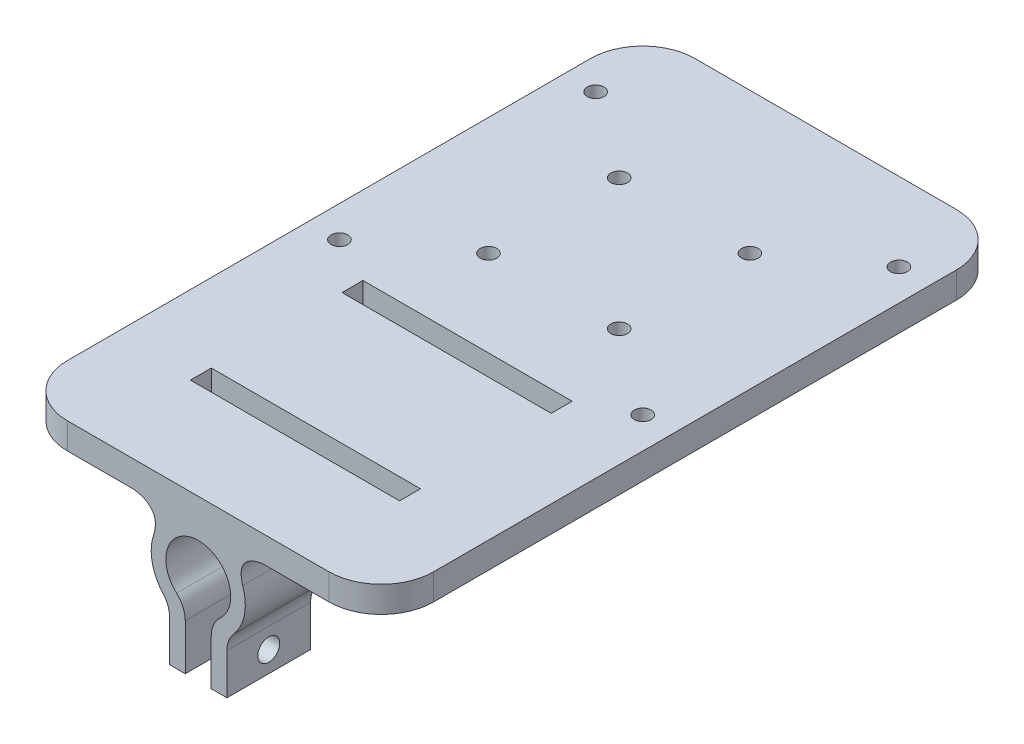
from build123d import *

# Parameters (mm, degrees)
BOSS_EXTRUDE2_START = 10
SKETCH3_W           = 70
SKETCH3_H           = 5
BOSS_EXTRUDE2_DEPTH = 120
BOSS_EXTRUDE3_START = 18
BOSS_EXTRUDE3_DEPTH = 8
SKETCH4_R           = 2.1
CUT_EXTRUDE1_DEPTH  = 11
FILLET1_R           = 10
SKETCH5_R           = 1.6
CUT_EXTRUDE2_DEPTH  = 11
CUT_EXTRUDE5_REACH  = 140.071
SKETCH7_R           = 1.6
CUT_EXTRUDE6_REACH  = 140.071
SKETCH6_W           = 40
SKETCH6_H           = 4


with BuildPart() as part:
    # Sketch3 → Boss-Extrude2 (new body)
    with BuildSketch(Plane.XY.offset(BOSS_EXTRUDE2_START)):
        with Locations((0, 11)):
            Rectangle(SKETCH3_W, SKETCH3_H)
    extrude(amount=BOSS_EXTRUDE2_DEPTH)

    # Sketch1 → Boss-Extrude3 (add, symmetric)
    with BuildSketch(Plane.XY.offset(BOSS_EXTRUDE3_START)):
        with BuildLine():
            Line((-12.351801858, 8.5), (12.351801858, 8.5))
            add(Edge.make_bspline(
                [(12.351801858, 8.5), (9.979182818, 8.152861079), (7.300358033, 7.013004111), (8.498185188, 2.963249653)],
                knots=[0, 0, 0, 0, 1, 1, 1, 1], degree=3))
            ThreePointArc((8.498185188, 2.963249653), (8.830462519, -1.738658018), (6.740539187, -5.96365085))
            ThreePointArc((6.740539187, -5.96365085), (5.809616385, -7.505310599), (5.48528318, -9.276790212))
            Line((5.48528318, -9.276790212), (5.48528318, -17.135241302))
            Line((5.48528318, -17.135241302), (3.98528318, -17.135241302))
            Line((3.98528318, -17.135241302), (2.48528318, -17.135241302))
            Line((2.48528318, -17.135241302), (2.48528318, -8.331298561))
            ThreePointArc((2.48528318, -8.331298561), (2.918653056, -6.295152862), (4.143638903, -4.611968846))
            ThreePointArc((4.143638903, -4.611968846), (0, 6.2), (-4.143638903, -4.611968846))
            ThreePointArc((-4.143638903, -4.611968846), (-2.918653056, -6.295152862), (-2.48528318, -8.331298561))
            Line((-2.48528318, -8.331298561), (-2.48528318, -17.135241302))
            Line((-2.48528318, -17.135241302), (-3.98528318, -17.135241302))
            Line((-3.98528318, -17.135241302), (-5.48528318, -17.135241302))
            Line((-5.48528318, -17.135241302), (-5.48528318, -9.276790212))
            ThreePointArc((-5.48528318, -9.276790212), (-5.809616385, -7.505310599), (-6.740539187, -5.96365085))
            ThreePointArc((-6.740539187, -5.96365085), (-8.830462519, -1.738658018), (-8.498185188, 2.963249653))
            add(Edge.make_bspline(
                [(-12.351801858, 8.5), (-9.979182818, 8.152861079), (-7.300358033, 7.013004111), (-8.498185188, 2.963249653)],
                knots=[0, 0, 0, 0, 1, 1, 1, 1], degree=3))
        make_face()
    boss_extrude3 = extrude(amount=BOSS_EXTRUDE3_DEPTH, both=True)

    # Sketch4 → Cut-Extrude1 (cut)
    with BuildSketch(Plane.ZY.offset(5.48528318)):
        with Locations((18, -13.137995298)):
            Circle(SKETCH4_R)
    cut_extrude1 = extrude(amount=-CUT_EXTRUDE1_DEPTH, mode=Mode.SUBTRACT)

    # Mirror2: Boss-Extrude3, Cut-Extrude1 across plane
    add(boss_extrude3.mirror(Plane.XY.offset(70)))
    add(cut_extrude1.mirror(Plane.XY.offset(70)), mode=Mode.SUBTRACT)

    # Fillet1
    fillet1_edges = [part.edges().sort_by_distance(p)[0] for p in [
        (35, 11, 10),
        (35, 11, 130),
        (-35, 11, 130),
        (-35, 11, 10),
    ]]
    fillet(fillet1_edges, radius=FILLET1_R)

    # Sketch5 → Cut-Extrude2 (cut)
    with BuildSketch(Plane(origin=(0, 13.5, 0), x_dir=(1, 0, 0), z_dir=(0, 1, 0))):
        with Locations((29, -25)):
            Circle(SKETCH5_R)
        with Locations((29, -74)):
            Circle(SKETCH5_R)
        with Locations((-29, -74)):
            Circle(SKETCH5_R)
        with Locations((-29, -25)):
            Circle(SKETCH5_R)
    extrude(amount=-CUT_EXTRUDE2_DEPTH, mode=Mode.SUBTRACT)

    # Sketch7 → Cut-Extrude5 (cut, up to next)
    with BuildSketch(Plane(origin=(0, 13.5, 0), x_dir=(1, 0, 0), z_dir=(0, 1, 0)), mode=Mode.PRIVATE) as cut_extrude5_sk1:
        with Locations((12.5, -37)):
            Circle(SKETCH7_R)
    cut_extrude5_tool1 = extrude(cut_extrude5_sk1.sketch, amount=-CUT_EXTRUDE5_REACH, mode=Mode.PRIVATE) & part.part
    # Sketch7 → Cut-Extrude5 (cut, up to next)
    with BuildSketch(Plane(origin=(0, 13.5, 0), x_dir=(1, 0, 0), z_dir=(0, 1, 0)), mode=Mode.PRIVATE) as cut_extrude5_sk2:
        with Locations((12.5, -62)):
            Circle(SKETCH7_R)
    cut_extrude5_tool2 = extrude(cut_extrude5_sk2.sketch, amount=-CUT_EXTRUDE5_REACH, mode=Mode.PRIVATE) & part.part
    # Sketch7 → Cut-Extrude5 (cut, up to next)
    with BuildSketch(Plane(origin=(0, 13.5, 0), x_dir=(1, 0, 0), z_dir=(0, 1, 0)), mode=Mode.PRIVATE) as cut_extrude5_sk3:
        with Locations((-12.5, -62)):
            Circle(SKETCH7_R)
    cut_extrude5_tool3 = extrude(cut_extrude5_sk3.sketch, amount=-CUT_EXTRUDE5_REACH, mode=Mode.PRIVATE) & part.part
    # Sketch7 → Cut-Extrude5 (cut, up to next)
    with BuildSketch(Plane(origin=(0, 13.5, 0), x_dir=(1, 0, 0), z_dir=(0, 1, 0)), mode=Mode.PRIVATE) as cut_extrude5_sk4:
        with Locations((-12.5, -37)):
            Circle(SKETCH7_R)
    cut_extrude5_tool4 = extrude(cut_extrude5_sk4.sketch, amount=-CUT_EXTRUDE5_REACH, mode=Mode.PRIVATE) & part.part
    add(cut_extrude5_tool1.solids().sort_by_distance((12.5, 13.5, 37))[0], mode=Mode.SUBTRACT)
    add(cut_extrude5_tool2.solids().sort_by_distance((12.5, 13.5, 62))[0], mode=Mode.SUBTRACT)
    add(cut_extrude5_tool3.solids().sort_by_distance((-12.5, 13.5, 62))[0], mode=Mode.SUBTRACT)
    add(cut_extrude5_tool4.solids().sort_by_distance((-12.5, 13.5, 37))[0], mode=Mode.SUBTRACT)

    # Sketch6 → Cut-Extrude6 (cut, up to next)
    with BuildSketch(Plane(origin=(0, 13.5, 0), x_dir=(1, 0, 0), z_dir=(0, 1, 0)), mode=Mode.PRIVATE) as cut_extrude6_sk1:
        with Locations((0, -80.5)):
            Rectangle(SKETCH6_W, SKETCH6_H)
    cut_extrude6_tool1 = extrude(cut_extrude6_sk1.sketch, amount=-CUT_EXTRUDE6_REACH, mode=Mode.PRIVATE) & part.part
    # Sketch6 → Cut-Extrude6 (cut, up to next)
    with BuildSketch(Plane(origin=(0, 13.5, 0), x_dir=(1, 0, 0), z_dir=(0, 1, 0)), mode=Mode.PRIVATE) as cut_extrude6_sk2:
        with Locations((0, -109.5)):
            Rectangle(SKETCH6_W, SKETCH6_H)
    cut_extrude6_tool2 = extrude(cut_extrude6_sk2.sketch, amount=-CUT_EXTRUDE6_REACH, mode=Mode.PRIVATE) & part.part
    add(cut_extrude6_tool1.solids().sort_by_distance((0, 13.5, 80.5))[0], mode=Mode.SUBTRACT)
    add(cut_extrude6_tool2.solids().sort_by_distance((0, 13.5, 109.5))[0], mode=Mode.SUBTRACT)


solid = part.part
